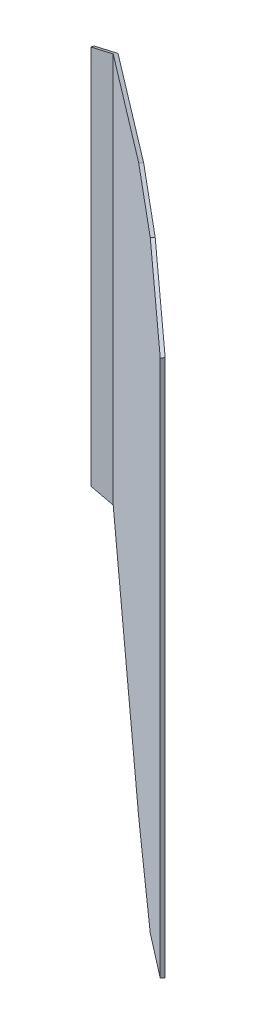
from build123d import *

# Parameters (mm, degrees)
WYCI_GNI_CIE_CIENKA_CIANKA1_DEPTH      = 400
WYCI_GNI_CIE_CIENKA_CIANKA1_DEPTH_BACK = 400
LUSTRO1_START                          = 275.975094607
LUSTRO1_DEPTH                          = 4


# Read off the part's stored shape, not the designer's step: Lustro1
with BuildPart() as part:
    # Szkic1 → Wyciągnięcie-cienka ścianka1 (new, two sides: drawn at the far end of the back side and taken through both)
    with BuildSketch(Plane(origin=(0, 0, 0), x_dir=(1, 0, 0), z_dir=(0, 1, 0)).offset(-WYCI_GNI_CIE_CIENKA_CIANKA1_DEPTH_BACK)):
        Polygon((958.263871938, -462.035437036), (545, -102.790633942), (517.881642578, -102.790633942), (517.881642578, -106.790633942), (543.504461282, -106.790633942), (955.639635822, -465.054275357), align=None)
    extrude(amount=WYCI_GNI_CIE_CIENKA_CIANKA1_DEPTH + WYCI_GNI_CIE_CIENKA_CIANKA1_DEPTH_BACK)

    # Cięcie powierzchnią3
    split(bisect_by=Plane(origin=(-14.708403282, 64.029657214, -16.335336758), x_dir=(0.6328754019355285, 0.32469887066665293, 0.7028793417171568), z_dir=(0.2172659522131463, -0.9458174471787886, 0.2412982855743377)), keep=Keep.TOP)

    # Cięcie powierzchnią4
    split(bisect_by=Plane(origin=(-14.708403282, -64.029657214, -16.335336758), x_dir=(0.6328754019353329, -0.32469887066665304, 0.7028793417173329), z_dir=(-0.21726595221314635, -0.9458174471787884, -0.24129828557433775)), keep=Keep.BOTTOM)

    # Cięcie powierzchnią5
    split(bisect_by=Plane(origin=(141.124135037, -578.697205105, 122.677338974), x_dir=(0.718149384400474, 0.30747157670526803, 0.6242777356302215), z_dir=(0.2320517445856664, -0.9515572654960797, 0.20171950405543876)), keep=Keep.BOTTOM)

    # Cięcie powierzchnią6
    split(bisect_by=Plane(origin=(-23.206221207, -200.985361995, -20.17286033), x_dir=(0.74602943431762, -0.15122940248105377, 0.6485134932728503), z_dir=(-0.11413427886381658, -0.9884986938915112, -0.09921541494653495)), keep=Keep.BOTTOM)

    # Lustro1 outline → Lustro1 (cut)
    with BuildSketch(Plane(origin=(0, 0, 0), x_dir=(0.754709580222771, 0, 0.6560590289905084), z_dir=(0.6560590289905085, 0, -0.7547095802227708)).offset(LUSTRO1_START)):
        Polygon((1026.333444714, -307.485100364), (910.348198503, -344.962788591), (775.810550903, -324.380011716), (774, -324.103017388), (774, -400), (1026.333444714, -400), align=None)
    extrude(amount=LUSTRO1_DEPTH, mode=Mode.SUBTRACT)


solid = part.part
